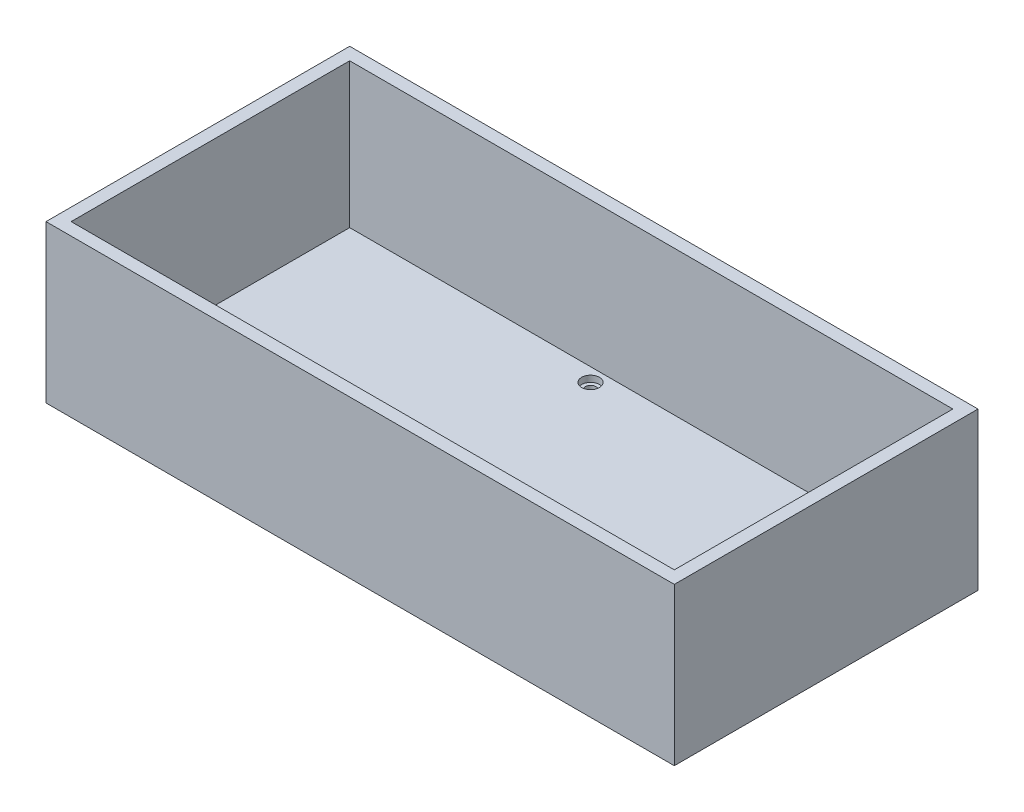
from build123d import *

# Parameters (mm, degrees)
SKETCH_1_W          = 300
SKETCH_1_H          = 145
EXTRUDE_1_DEPTH     = 75
SHELL_1_T           = -6
SKETCH_2_R          = 2.55
CUT_EXTRUDE_1_DEPTH = 181.325400318
SKETCH_3_R          = 4.25
CUT_EXTRUDE_2_DEPTH = 3


with BuildPart() as part:
    # ｽｹｯﾁ1 → ﾎﾞｽ - 押し出し1 (new body)
    with BuildSketch(Plane(origin=(0, 0, 0), x_dir=(1, 0, 0), z_dir=(0, 1, 0))):
        Rectangle(SKETCH_1_W, SKETCH_1_H)
    extrude(amount=EXTRUDE_1_DEPTH)

    # ｼｪﾙ1
    shell_1_openings = [part.faces().sort_by_distance(p)[0] for p in [
        (0, 75, 0),
    ]]
    offset(amount=SHELL_1_T, openings=shell_1_openings, kind=Kind.INTERSECTION)

    # ｽｹｯﾁ2 → ｶｯﾄ - 押し出し1 (cut, through all)
    with BuildSketch(Plane(origin=(0, 6, 0), x_dir=(1, 0, 0), z_dir=(0, 1, 0))):
        with Locations((140, 60)):
            Circle(SKETCH_2_R)
        with Locations((140, -60)):
            Circle(SKETCH_2_R)
        with Locations((-22.5, -60)):
            Circle(SKETCH_2_R)
        with Locations((-22.5, 60)):
            Circle(SKETCH_2_R)
    extrude(amount=-CUT_EXTRUDE_1_DEPTH, mode=Mode.SUBTRACT)

    # ｽｹｯﾁ3 → ｶｯﾄ - 押し出し2 (cut)
    with BuildSketch(Plane(origin=(0, 6, 0), x_dir=(1, 0, 0), z_dir=(0, 1, 0))):
        with Locations((140, 60)):
            Circle(SKETCH_3_R)
        with Locations((-22.5, 60)):
            Circle(SKETCH_3_R)
        with Locations((-22.5, -60)):
            Circle(SKETCH_3_R)
        with Locations((140, -60)):
            Circle(SKETCH_3_R)
    extrude(amount=-CUT_EXTRUDE_2_DEPTH, mode=Mode.SUBTRACT)


solid = part.part
